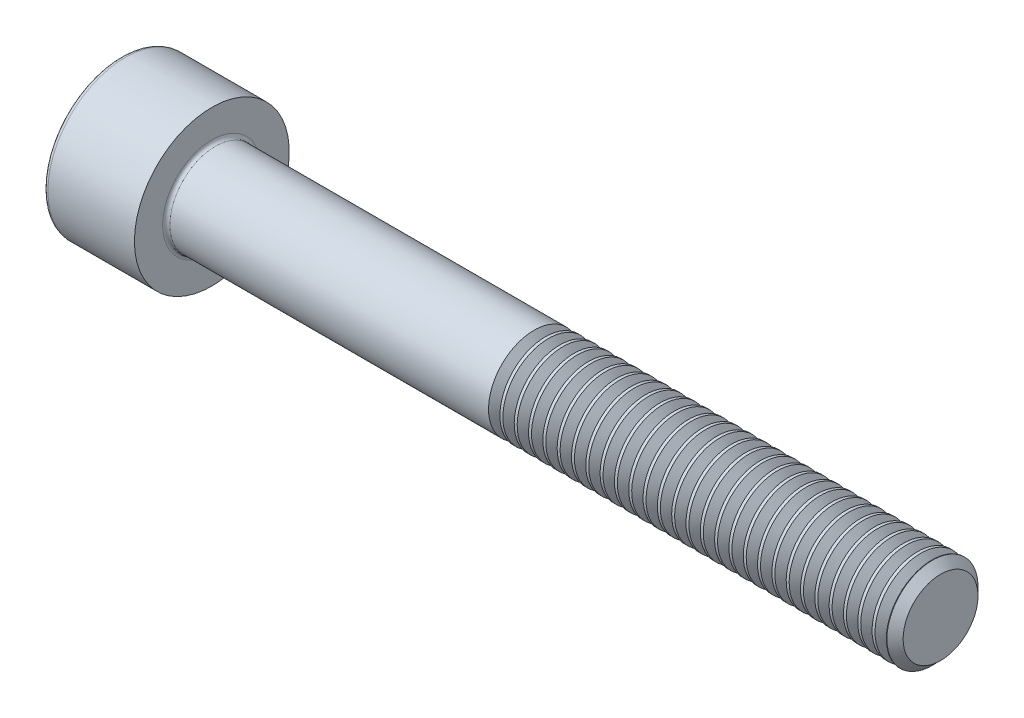
from build123d import *

# Parameters (mm, degrees)
FILLET1_R       = 0.2
FILLET2_R       = 0.25
HEX_2_DEPTH     = 2.5
THDSCHPAT_COUNT = 29
THDSCHPAT_PITCH = 0.785714286


with BuildPart() as part:
    # BodySke → Base-Revolve (revolve)
    with BuildSketch(Plane.XY):
        Polygon((0, 0), (0, 4.25), (5, 4.25), (5, 2.5), (44.555, 2.5), (45, 2.055), (45, 0), align=None)
    revolve(axis=Axis((-31.75, 0, 0), (1, 0, 0)))

    # Fillet1
    fillet1_edges = [part.edges().sort_by_distance(p)[0] for p in [
        (5, -2.5, 0),
    ]]
    fillet(fillet1_edges, radius=FILLET1_R)

    # Fillet2
    fillet2_edges = [part.edges().sort_by_distance(p)[0] for p in [
        (0, -4.25, 0),
    ]]
    fillet(fillet2_edges, radius=FILLET2_R)

    # Sketch2 → Hex-PreBroach (revolve, cut)
    with BuildSketch(Plane.XY):
        Polygon((0, 2.042), (2.5, 2.042), (3.67894925, 0), (0, 0), align=None)
    revolve(axis=Axis((0, 0, 0), (1, 0, 0)), mode=Mode.SUBTRACT)

    # Sketch3 → Hex 2 (cut)
    with BuildSketch(Plane(origin=(0, 0, 0), x_dir=(0, 0.500000000000001, 0.866025403784438), z_dir=(-1, 0, 0))):
        Polygon((1.17894925, 2.042), (-1.17894925, 2.042), (-2.357898499, 0), (-1.17894925, -2.042), (1.17894925, -2.042), (2.357898499, 0), align=None)
    extrude(amount=-HEX_2_DEPTH, mode=Mode.SUBTRACT)

    # ThdSchSke → ThreadSchematic (revolve, cut)
    with BuildSketch(Plane.XY):
        Polygon((23, -2.055), (22.688407645, -2.5), (22.688407645, -3.125), (23.311592355, -3.125), (23.311592355, -2.5), align=None)
    threadschematic = revolve(axis=Axis((-3.175, 0, 0), (1, 0, 0)), mode=Mode.SUBTRACT)

    # ThdSchPat: ThreadSchematic ×29
    with Locations(*[(i * THDSCHPAT_PITCH, 0, 0) for i in range(1, THDSCHPAT_COUNT)]):
        add(threadschematic, mode=Mode.SUBTRACT)


solid = part.part
